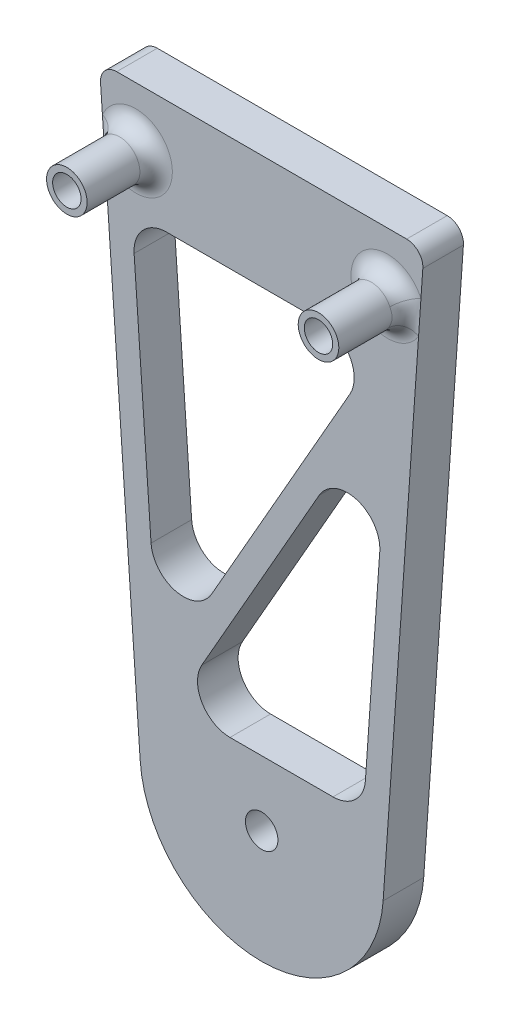
from build123d import *

# Parameters (mm, degrees)
CROQUIS1_R              = 2
CROQUIS1_R_2            = 1.75
SALIENTE_EXTRUIR1_DEPTH = 2.5
CROQUIS1_3_R            = 2.5
CROQUIS1_3_R_2          = 1.75
SALIENTE_EXTRUIR2_DEPTH = 11
REDONDEO1_R             = 2
REDONDEO2_R             = 2
CROQUIS2_R              = 3
CORTAR_EXTRUIR1_DEPTH   = 2
REDONDEO3_R             = 4


with BuildPart() as part:
    # Croquis1 → Saliente-Extruir1 (new, symmetric)
    with BuildSketch(Plane.XY):
        with BuildLine():
            Line((20.001432119, 0), (-20.001432119, 0))
            Line((-20.001432119, 0), (-14.963460754, -72.046347106))
            ThreePointArc((-14.963460754, -72.046347106), (0, -86), (14.963460754, -72.046347106))
            Line((14.963460754, -72.046347106), (20.001432119, 0))
        make_face()
        with Locations((0, -72.046347106)):
            Circle(CROQUIS1_R, mode=Mode.SUBTRACT)
        Polygon((-12.704099543, -61.349956664), (-16.011890152, -14.046347106), (14.28491785, -14.046347106), align=None, mode=Mode.SUBTRACT)
        Polygon((12.515549555, -64.046347106), (-10.788577252, -64.046347106), (15.770666891, -17.496000466), align=None, mode=Mode.SUBTRACT)
        with Locations((-15.5, -7.276347106)):
            Circle(CROQUIS1_R_2, mode=Mode.SUBTRACT)
        with Locations((15.5, -7.276347106)):
            Circle(CROQUIS1_R_2, mode=Mode.SUBTRACT)
    extrude(amount=SALIENTE_EXTRUIR1_DEPTH, both=True)

    # Croquis1<3> → Saliente-Extruir2 (add)
    # profile 1 of 2: a face of its own
    with BuildSketch(Plane.XY):
        with Locations((-15.5, -7.276347106)):
            Circle(CROQUIS1_3_R)
        with Locations((-15.5, -7.276347106)):
            Circle(CROQUIS1_3_R_2, mode=Mode.SUBTRACT)
    # profile 2 of 2: a face of its own
    with BuildSketch(Plane.XY):
        with Locations((15.5, -7.276347106)):
            Circle(CROQUIS1_3_R)
        with Locations((15.5, -7.276347106)):
            Circle(CROQUIS1_3_R_2, mode=Mode.SUBTRACT)
    extrude(amount=SALIENTE_EXTRUIR2_DEPTH)

    # Redondeo1
    redondeo1_edges = [part.edges().sort_by_distance(p)[0] for p in [
        (13, -7.276347106, 2.5),
        (-18, -7.276347106, 2.5),
    ]]
    fillet(redondeo1_edges, radius=REDONDEO1_R)

    # Redondeo2
    redondeo2_edges = [part.edges().sort_by_distance(p)[0] for p in [
        (20.001432119, 0, 0),
        (-20.001432119, 0, 0),
    ]]
    fillet(redondeo2_edges, radius=REDONDEO2_R)

    # Croquis2 → Cortar-Extruir1 (cut)
    with BuildSketch(Plane(origin=(0, 0, -2.5), x_dir=(-1, 0, 0), z_dir=(0, 0, -1))):
        with Locations((-15.5, -7.276347106)):
            Circle(CROQUIS2_R)
        with Locations((15.5, -7.276347106)):
            Circle(CROQUIS2_R)
    extrude(amount=-CORTAR_EXTRUIR1_DEPTH, mode=Mode.SUBTRACT)

    # Redondeo3
    redondeo3_edges = [part.edges().sort_by_distance(p)[0] for p in [
        (-16.011890152, -14.046347106, 0),
        (12.515549555, -64.046347106, 0),
        (-10.788577252, -64.046347106, 0),
        (-12.704099543, -61.349956664, 0),
        (14.28491785, -14.046347106, 0),
        (15.770666891, -17.496000466, 0),
    ]]
    fillet(redondeo3_edges, radius=REDONDEO3_R)


solid = part.part
